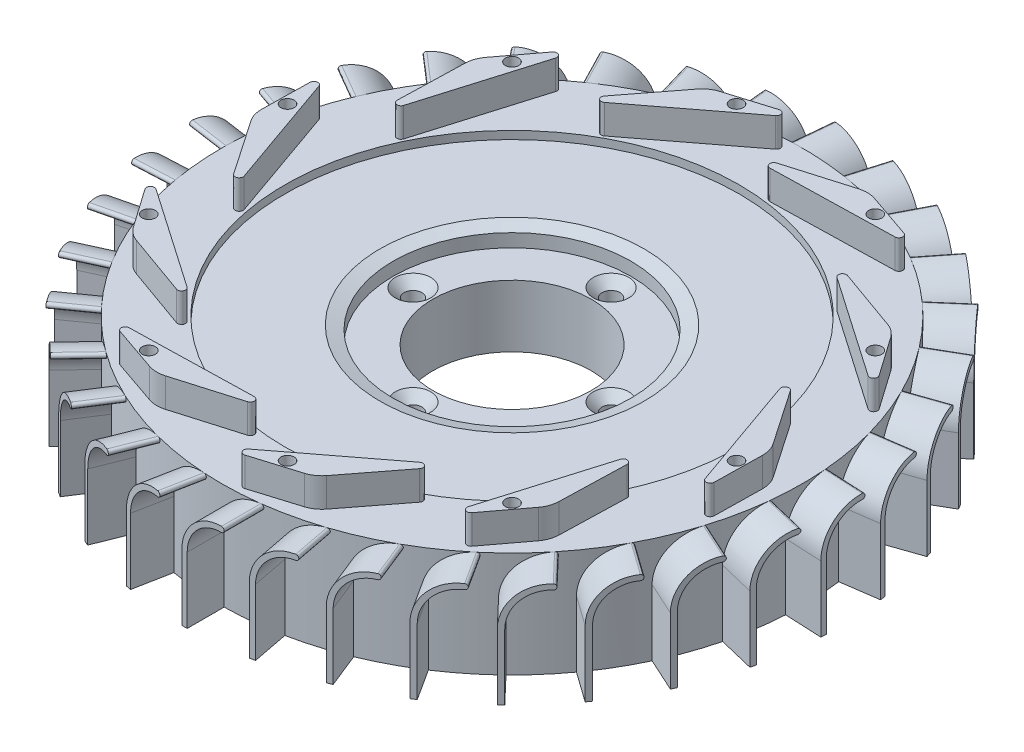
from build123d import *

# Parameters (mm, degrees)
Y_KSEKLIK_EKSTR_ZYON1_DEPTH = 9
DAIRESEL_KAPLAMA1_COUNT     = 33
Y_KSEKLIK_EKSTR_ZYON2_DEPTH = 5.5
DAIRESEL_KAPLAMA2_COUNT     = 10
DAIRESEL_KAPLAMA3_COUNT     = 10
DAIRESEL_KAPLAMA4_COUNT     = 4


with BuildPart() as part:
    # Çizim1 → Döndür1 (revolve)
    with BuildSketch(Plane.XY):
        with BuildLine():
            Line((-52, 11.921777193), (-55, 11.921777193))
            Line((-55, 11.921777193), (-55, 31.921777193))
            Line((-55, 31.921777193), (-43, 31.921777193))
            Line((-43, 31.921777193), (-43, 30.421777193))
            Line((-43, 30.421777193), (-25, 30.421777193))
            Line((-25, 30.421777193), (-22.5, 29.657450489))
            Line((-22.5, 29.657450489), (-22.5, 27.171777193))
            Line((-22.5, 27.171777193), (-15, 27.171777193))
            Line((-15, 27.171777193), (-15, 15.421777193))
            Line((-15, 15.421777193), (-22.5, 15.421777193))
            Line((-22.5, 15.421777193), (-22.5, 10.421777193))
            Line((-22.5, 10.421777193), (-24.5, 10.421777193))
            Line((-24.5, 10.421777193), (-29.83, 21.921777193))
            Line((-29.83, 21.921777193), (-47, 21.921777193))
            ThreePointArc((-47, 21.921777193), (-50.535533906, 20.457311099), (-52, 16.921777193))
            Line((-52, 16.921777193), (-52, 11.921777193))
        make_face()
    revolve(axis=Axis((0, 0, 0), (0, 1, 0)))

    # Çizim2 → Yükseklik-Ekstrüzyon1 (add)
    with BuildSketch(Plane.XY.offset(53)):
        with BuildLine():
            Line((0.5, 11.921777193), (-0.5, 11.921777193))
            Line((-0.5, 11.921777193), (-0.5, 24.421777193))
            ThreePointArc((-0.5, 24.421777193), (1.696699141, 29.725078052), (7, 31.921777193))
            ThreePointArc((7, 31.921777193), (7.5, 31.421777193), (7, 30.921777193))
            ThreePointArc((7, 30.921777193), (2.403805922, 29.017971271), (0.5, 24.421777193))
            Line((0.5, 24.421777193), (0.5, 11.921777193))
        make_face()
    y_kseklik_ekstr_zyon1 = extrude(amount=Y_KSEKLIK_EKSTR_ZYON1_DEPTH)

    # Dairesel Kaplama1: Yükseklik-Ekstrüzyon1 ×33 about axis
    dairesel_kaplama1_axis = Axis((0, 0, 0), (0, -1, 0))
    for i in range(1, DAIRESEL_KAPLAMA1_COUNT):
        add(y_kseklik_ekstr_zyon1.rotate(dairesel_kaplama1_axis, i * 360 / DAIRESEL_KAPLAMA1_COUNT))

    # Çizim3 → Yükseklik-Ekstrüzyon2 (add)
    with BuildSketch(Plane(origin=(0, 31.921777193, 0), x_dir=(1, 0, 0), z_dir=(0, 1, 0))):
        with BuildLine():
            Line((5.465643826, 44.606376473), (17.500565003, 48.143492107))
            ThreePointArc((17.500565003, 48.143492107), (19.023509931, 48.345109394), (20.53578241, 48.074845196))
            Line((20.53578241, 48.074845196), (29.038180864, 45.152289017))
            ThreePointArc((29.038180864, 45.152289017), (29.53556177, 44.328337592), (28.81242178, 43.693237387))
            Line((28.81242178, 43.693237387), (5.695167354, 43.137027806))
            ThreePointArc((5.695167354, 43.137027806), (4.936113491, 43.771058773), (5.465643826, 44.606376473))
        make_face()
    y_kseklik_ekstr_zyon2 = extrude(amount=Y_KSEKLIK_EKSTR_ZYON2_DEPTH)

    # Dairesel Kaplama2: Yükseklik-Ekstrüzyon2 ×10 about axis
    dairesel_kaplama2_axis = Axis((0, 0, 0), (0, -1, 0))
    for i in range(1, DAIRESEL_KAPLAMA2_COUNT):
        add(y_kseklik_ekstr_zyon2.rotate(dairesel_kaplama2_axis, i * 360 / DAIRESEL_KAPLAMA2_COUNT))

    # Çizim8 → M3 Dişli Delik3 (revolve, cut)
    with BuildSketch(Plane(origin=(-8, 37.421777193, -50.5), x_dir=(0, 0, 1), z_dir=(1, 0, 0))):
        Polygon((0, 0), (0, 8.251075774), (1.25, 7.5), (1.25, 0), align=None)
    m3_di_li_delik3 = revolve(axis=Axis((-8, 43.771777193, -50.5), (0, -1, 0)), mode=Mode.SUBTRACT)

    # Dairesel Kaplama3: M3 Dişli Delik3 ×10 about axis
    dairesel_kaplama3_axis = Axis((0, 0, 0), (0, -1, 0))
    for i in range(1, DAIRESEL_KAPLAMA3_COUNT):
        add(m3_di_li_delik3.rotate(dairesel_kaplama3_axis, i * 360 / DAIRESEL_KAPLAMA3_COUNT), mode=Mode.SUBTRACT)

    # Çizim10 → M3 Altıgen Alyan Havşa Başlı Kör Vida İçin Havşa1 (revolve, cut)
    with BuildSketch(Plane(origin=(0, 27.171777193, -18.75), x_dir=(0, 0, 1), z_dir=(1, 0, 0))):
        Polygon((0, 0), (0, 12.771463052), (1.7, 11.75), (1.7, 1.66), (3.36, 0), align=None)
    m3_alt_gen_alyan_hav_a_ba_l_k_r_vida_i = revolve(axis=Axis((0, 33.521777193, -18.75), (0, -1, 0)), mode=Mode.SUBTRACT)

    # Dairesel Kaplama4: M3 Altıgen Alyan Havşa Başlı Kör Vida İçin Havşa1 ×4 about axis
    dairesel_kaplama4_axis = Axis((0, 0, 0), (0, -1, 0))
    for i in range(1, DAIRESEL_KAPLAMA4_COUNT):
        add(m3_alt_gen_alyan_hav_a_ba_l_k_r_vida_i.rotate(dairesel_kaplama4_axis, i * 360 / DAIRESEL_KAPLAMA4_COUNT), mode=Mode.SUBTRACT)


solid = part.part
